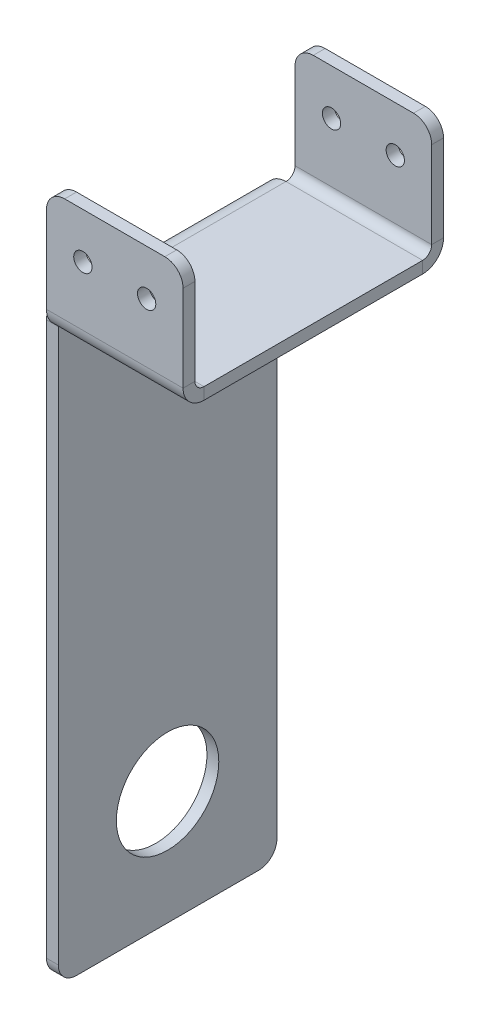
from build123d import *

# Parameters (mm, degrees)
SKETCH1_W               = 38.1
SKETCH1_H               = 60.96
BASE_FLANGE1_DEPTH      = 3.302
EDGE_FLANGE1_DEPTH      = 38.1
EDGE_FLANGE1_BEND_DEPTH = 38.1
EDGE_FLANGE2_DEPTH      = 60.96
SKETCH17_R              = 14.28115
CUT_EXTRUDE1_DEPTH      = 175.665958469
F_1_4_20_TAPPED_HOLE1_D = 5.1054
FILLET1_R               = 5.08


# Sheet-metal steps are written as plain solids
with BuildPart() as part:
    # Sketch1 → Base-Flange1 (new body)
    with BuildSketch(Plane(origin=(0, 0, 0), x_dir=(1, 0, 0), z_dir=(0, 1, 0))):
        Rectangle(SKETCH1_W, SKETCH1_H)
    extrude(amount=-BASE_FLANGE1_DEPTH)

    # Edge-Flange1 section (across the edge) → Edge-Flange1 (add)
    with BuildSketch(Plane(origin=(-19.05, 0, 33.02), x_dir=(0, 0, -1), z_dir=(1, 0, 0))):
        with BuildLine():
            Line((-3.302, 2.54), (-3.302, 31.75))
            Line((-3.302, 31.75), (0, 31.75))
            Line((0, 31.75), (0, 2.54))
            ThreePointArc((0, 2.54), (0.743948776, 0.743948776), (2.54, 0))
            Line((2.54, 0), (2.54, -3.302))
            ThreePointArc((2.54, -3.302), (-1.590917816, -1.590917816), (-3.302, 2.54))
        make_face()
    extrude(amount=EDGE_FLANGE1_DEPTH)

    # Edge-Flange1 section 2 (across the edge) → Edge-Flange1 bend (add)
    with BuildSketch(Plane(origin=(19.05, 0, -33.02), x_dir=(0, 0, 1), z_dir=(-1, 0, 0))):
        with BuildLine():
            Line((-3.302, 2.54), (-3.302, 31.75))
            Line((-3.302, 31.75), (0, 31.75))
            Line((0, 31.75), (0, 2.54))
            ThreePointArc((0, 2.54), (0.743948776, 0.743948776), (2.54, 0))
            Line((2.54, 0), (2.54, -3.302))
            ThreePointArc((2.54, -3.302), (-1.590917816, -1.590917816), (-3.302, 2.54))
        make_face()
    extrude(amount=EDGE_FLANGE1_BEND_DEPTH)

    # Edge-Flange2 section (across the edge) → Edge-Flange2 (add)
    with BuildSketch(Plane(origin=(-21.59, -3.302, 30.48), x_dir=(1, 0, 0), z_dir=(0, 0, -1))):
        with BuildLine():
            Line((-3.302, 2.54), (-3.302, 161.798))
            Line((-3.302, 161.798), (0, 161.798))
            Line((0, 161.798), (0, 2.54))
            ThreePointArc((0, 2.54), (0.743948776, 0.743948776), (2.54, 0))
            Line((2.54, 0), (2.54, -3.302))
            ThreePointArc((2.54, -3.302), (-1.590917816, -1.590917816), (-3.302, 2.54))
        make_face()
    extrude(amount=EDGE_FLANGE2_DEPTH)

    # Sketch17 → Cut-Extrude1 (cut, through all)
    with BuildSketch(Plane.ZY.offset(24.892)):
        with Locations(Location((0, -133.2738, 0), (0, 0, 270))):
            Circle(SKETCH17_R)
    extrude(amount=-CUT_EXTRUDE1_DEPTH, mode=Mode.SUBTRACT)

    # 1/4-20 Tapped Hole1 (through all)
    with Locations(Plane.XY.offset(36.322)):
        with Locations((8.89, 19.05), (-8.89, 19.05)):
            Hole(F_1_4_20_TAPPED_HOLE1_D / 2)

    # Fillet1
    fillet1_edges = [part.edges().sort_by_distance(p)[0] for p in [
        (-19.05, 31.75, 34.671),
        (19.05, 31.75, 34.671),
        (19.05, 31.75, -34.671),
        (-19.05, 31.75, -34.671),
        (-23.241, -165.1, 30.48),
        (-23.241, -165.1, -30.48),
    ]]
    fillet(fillet1_edges, radius=FILLET1_R)


solid = part.part
